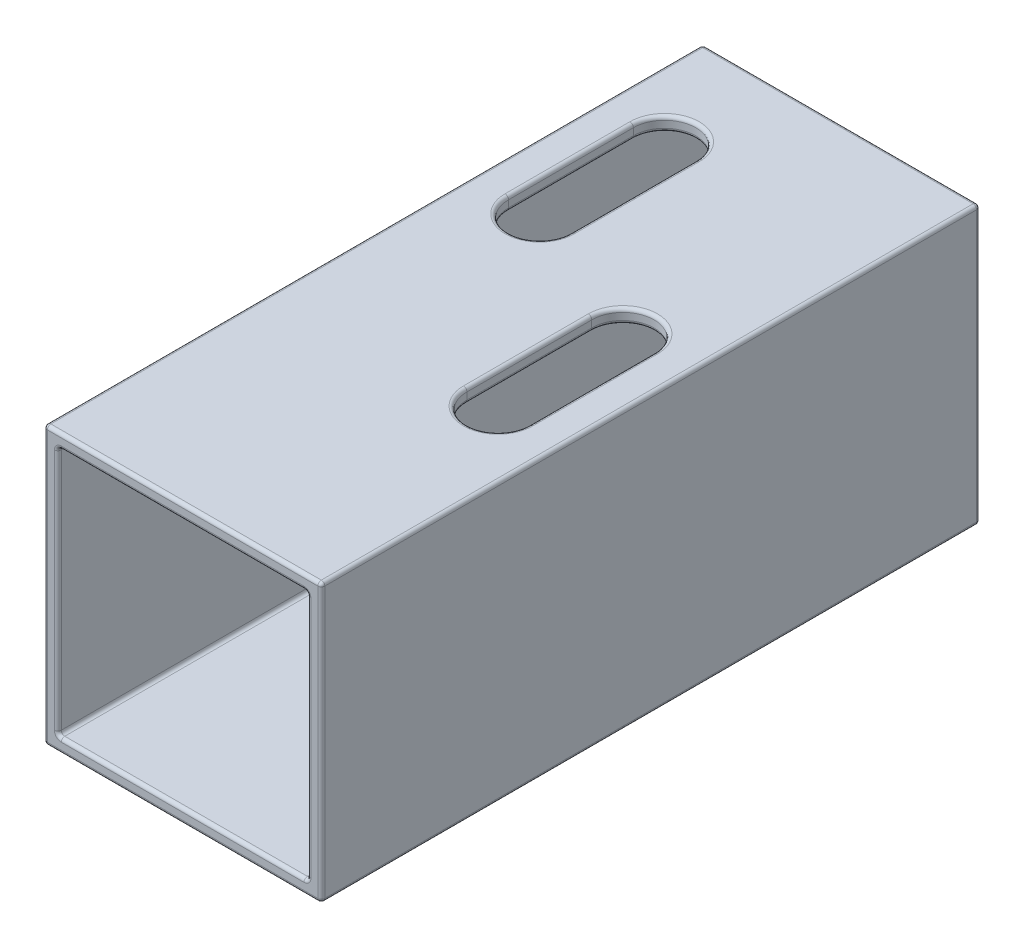
from build123d import *

# Parameters (mm, degrees)
SKIZZE1_W                       = 40
SKIZZE1_H                       = 40
SKIZZE1_W_2                     = 36
SKIZZE1_H_2                     = 36
AUFSATZ_LINEAR_AUSTRAGEN1_DEPTH = 232
SKIZZE4_W                       = 137
SKIZZE4_H                       = 61.891595387
SCHNITT_LINEAR_AUSTRAGEN2_DEPTH = 237.27103081
SKIZZE9_W                       = 9
SKIZZE9_H                       = 27
SCHNITT_LINEAR_AUSTRAGEN5_DEPTH = 106
VERRUNDUNG1_R                   = 4.5
VERRUNDUNG2_R                   = 4.5
VERRUNDUNG3_R                   = 4.5
VERRUNDUNG4_R                   = 4.5
SKIZZE10_W                      = 9
SKIZZE10_H                      = 27
SCHNITT_LINEAR_AUSTRAGEN6_DEPTH = 106
VERRUNDUNG5_R                   = 4.5
VERRUNDUNG6_R                   = 4.5
VERRUNDUNG7_R                   = 4.5
VERRUNDUNG8_R                   = 4.5
VERRUNDUNG9_R                   = 0.5


with BuildPart() as part:
    # Skizze1 → Aufsatz-Linear austragen1 (new body)
    with BuildSketch(Plane.XY):
        Rectangle(SKIZZE1_W, SKIZZE1_H)
        Rectangle(SKIZZE1_W_2, SKIZZE1_H_2, mode=Mode.SUBTRACT)
    extrude(amount=AUFSATZ_LINEAR_AUSTRAGEN1_DEPTH)

    # Skizze4 → Schnitt-Linear austragen2 (cut, through all)
    with BuildSketch(Plane.ZY.offset(20)):
        with Locations((163.5, -3.393842352)):
            Rectangle(SKIZZE4_W, SKIZZE4_H)
    extrude(amount=-SCHNITT_LINEAR_AUSTRAGEN2_DEPTH, mode=Mode.SUBTRACT)

    # Skizze9 → Schnitt-Linear austragen5 (cut, through all)
    with BuildSketch(Plane(origin=(0, 20, 0), x_dir=(1, 0, 0), z_dir=(0, 1, 0))):
        with Locations((10.5, -51)):
            Rectangle(SKIZZE9_W, SKIZZE9_H)
    extrude(amount=-SCHNITT_LINEAR_AUSTRAGEN5_DEPTH, mode=Mode.SUBTRACT)

    # Verrundung1
    verrundung1_edges = [part.edges().sort_by_distance(p)[0] for p in [
        (6, 19, 37.5),
        (15, 19, 37.5),
    ]]
    fillet(verrundung1_edges, radius=VERRUNDUNG1_R - 0.0001)  # a hair under: the kernel refuses the full size

    # Verrundung2
    verrundung2_edges = [part.edges().sort_by_distance(p)[0] for p in [
        (6, 19, 64.5),
        (15, 19, 64.5),
    ]]
    fillet(verrundung2_edges, radius=VERRUNDUNG2_R - 0.0001)  # a hair under: the kernel refuses the full size

    # Verrundung3
    verrundung3_edges = [part.edges().sort_by_distance(p)[0] for p in [
        (6, -19, 64.5),
        (15, -19, 64.5),
    ]]
    fillet(verrundung3_edges, radius=VERRUNDUNG3_R - 0.0001)  # a hair under: the kernel refuses the full size

    # Verrundung4
    verrundung4_edges = [part.edges().sort_by_distance(p)[0] for p in [
        (6, -19, 37.5),
        (15, -19, 37.5),
    ]]
    fillet(verrundung4_edges, radius=VERRUNDUNG4_R - 0.0001)  # a hair under: the kernel refuses the full size

    # Skizze10 → Schnitt-Linear austragen6 (cut, through all)
    with BuildSketch(Plane(origin=(0, 20, 0), x_dir=(1, 0, 0), z_dir=(0, 1, 0))):
        with Locations((-10.5, -24)):
            Rectangle(SKIZZE10_W, SKIZZE10_H)
    extrude(amount=-SCHNITT_LINEAR_AUSTRAGEN6_DEPTH, mode=Mode.SUBTRACT)

    # Verrundung5
    verrundung5_edges = [part.edges().sort_by_distance(p)[0] for p in [
        (-15, 19, 10.5),
        (-6, 19, 10.5),
    ]]
    fillet(verrundung5_edges, radius=VERRUNDUNG5_R - 0.0001)  # a hair under: the kernel refuses the full size

    # Verrundung6
    verrundung6_edges = [part.edges().sort_by_distance(p)[0] for p in [
        (-15, 19, 37.5),
        (-6, 19, 37.5),
    ]]
    fillet(verrundung6_edges, radius=VERRUNDUNG6_R - 0.0001)  # a hair under: the kernel refuses the full size

    # Verrundung7
    verrundung7_edges = [part.edges().sort_by_distance(p)[0] for p in [
        (-15, -19, 37.5),
        (-6, -19, 37.5),
    ]]
    fillet(verrundung7_edges, radius=VERRUNDUNG7_R - 0.0001)  # a hair under: the kernel refuses the full size

    # Verrundung8
    verrundung8_edges = [part.edges().sort_by_distance(p)[0] for p in [
        (-15, -19, 10.5),
        (-6, -19, 10.5),
    ]]
    fillet(verrundung8_edges, radius=VERRUNDUNG8_R - 0.0001)  # a hair under: the kernel refuses the full size

    # Verrundung9
    verrundung9_edges = [part.edges().sort_by_distance(p)[0] for p in [
        (10.5, 20, 37.5),
        (15, 20, 51),
        (6, 18, 51),
        (10.5, 18, 64.5),
        (10.5, 20, 64.5),
        (15, -18, 51),
        (15, -20, 51),
        (10.5, -20, 64.5),
        (10.5, -18, 64.5),
        (6, -18, 51),
        (6, -20, 51),
        (10.5, -18, 37.5),
        (10.5, -20, 37.5),
        (18, 0, 0),
        (0, 18, 0),
        (-18, 0, 0),
        (0, -18, 0),
        (-15, 20, 24),
        (-6, 18, 24),
        (-10.5, 18, 10.5),
        (-10.5, 20, 10.5),
        (-6, 20, 24),
        (-15, 18, 24),
        (-10.5, 18, 37.5),
        (-10.5, 20, 37.5),
        (-6, -18, 24),
        (-6, -20, 24),
        (-10.5, -20, 37.5),
        (-10.5, -18, 37.5),
        (-15, -18, 24),
        (-15, -20, 24),
        (-10.5, -18, 10.5),
        (-10.5, -20, 10.5),
        (-18, -18, 47.5),
        (18, -18, 47.5),
        (0, -18, 95),
        (-18, 18, 47.5),
        (18, 18, 47.5),
        (20, -20, 47.5),
        (-20, -20, 47.5),
        (-20, 20, 47.5),
        (20, 20, 47.5),
        (-20, 0, 95),
        (0, 20, 95),
        (20, 0, 95),
        (0, -20, 95),
        (0, 18, 95),
        (18, 0, 95),
        (-18, 0, 95),
        (0, -20, 0),
        (-20, 0, 0),
        (0, 20, 0),
        (20, 0, 0),
        (6, 20, 51),
        (15, 18, 51),
        (10.5, 18, 37.5),
    ]]
    fillet(verrundung9_edges, radius=VERRUNDUNG9_R)


solid = part.part
